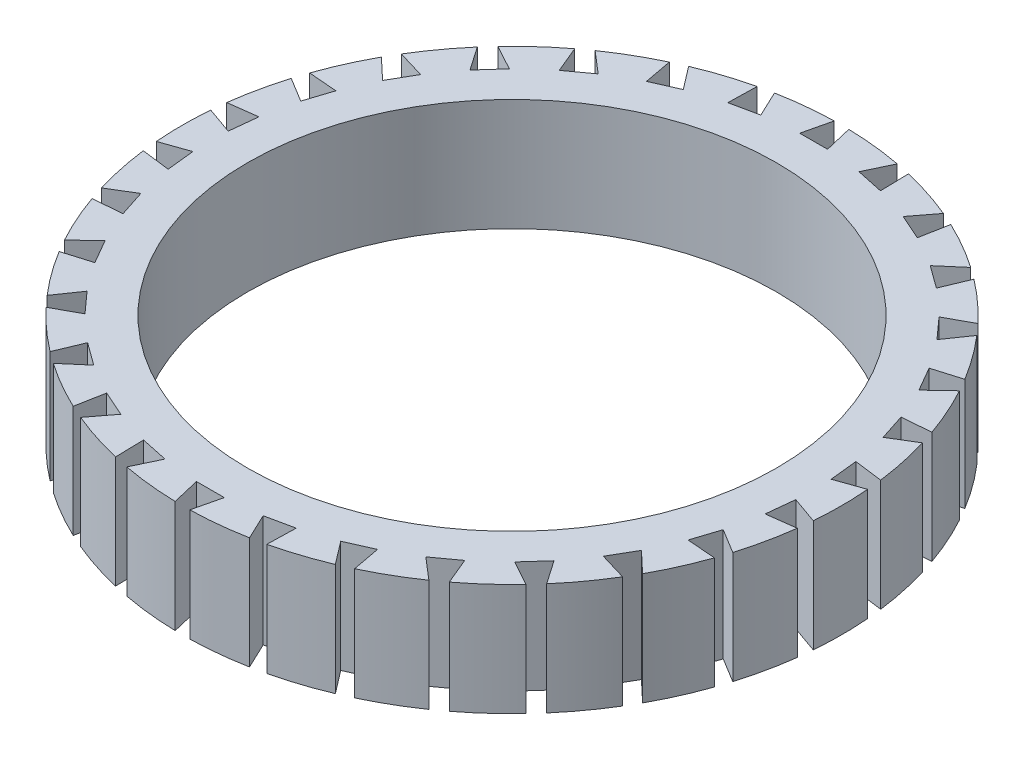
from build123d import *

# Parameters (mm, degrees)
SKETCH1_R           = 16.2
SKETCH1_R_2         = 13
BOSS_EXTRUDE1_DEPTH = 5.5
CUT_EXTRUDE1_DEPTH  = 24.561196914
CIRPATTERN1_COUNT   = 30


with BuildPart() as part:
    # Sketch1 → Boss-Extrude1 (new body)
    with BuildSketch(Plane(origin=(0, 0, 0), x_dir=(1, 0, 0), z_dir=(0, 1, 0))):
        Circle(SKETCH1_R)
        Circle(SKETCH1_R_2, mode=Mode.SUBTRACT)
    extrude(amount=BOSS_EXTRUDE1_DEPTH)

    # Sketch2 → Cut-Extrude1 (cut, through all)
    with BuildSketch(Plane(origin=(0, 0, 0), x_dir=(1, 0, 0), z_dir=(0, 1, 0))):
        Polygon((0.684684655, 14.824655601), (-0.684684655, 14.824655601), (-0.359045792, 16.196020688), (-0.359045792, 18.052836496), (0.359045792, 18.052836496), (0.359045792, 16.196020688), align=None)
    cut_extrude1 = extrude(amount=CUT_EXTRUDE1_DEPTH, mode=Mode.SUBTRACT)

    # CirPattern1: Cut-Extrude1 ×30 about axis
    cirpattern1_axis = Axis((0, 5.5, 0), (0, -1, 0))
    for i in range(1, CIRPATTERN1_COUNT):
        add(cut_extrude1.rotate(cirpattern1_axis, i * 360 / CIRPATTERN1_COUNT), mode=Mode.SUBTRACT)


solid = part.part
